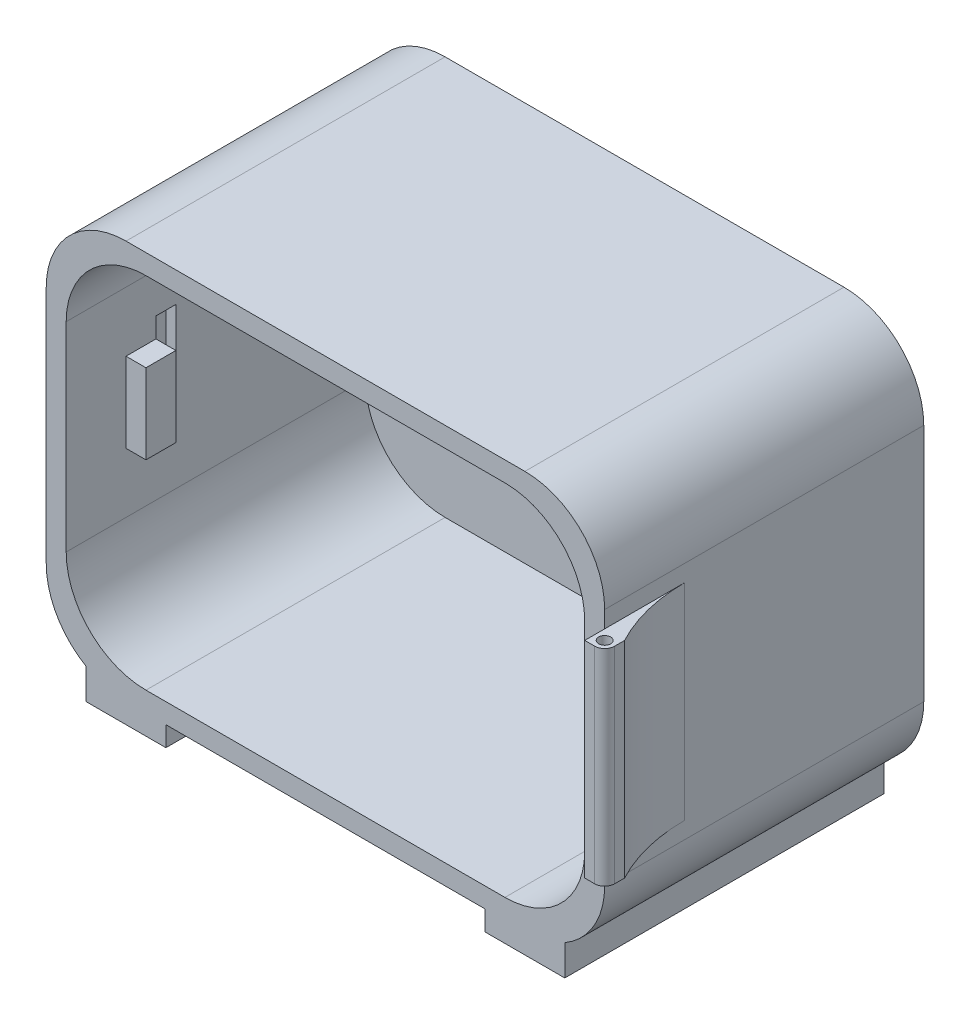
from build123d import *

# Parameters (mm, degrees)
BOSS_EXTRUDE1_DEPTH             = 95.25
BOSS_EXTRUDE2_DEPTH             = 6.35
SKETCH4_W                       = 25.4
SKETCH4_H                       = 101.6
BOSS_EXTRUDE3_DEPTH             = 6.35
BOSS_EXTRUDE3_DIRECTION_2_REACH = 187.35
BOSS_EXTRUDE5_DEPTH             = 32.766
BOSS_EXTRUDE5_DEPTH_BACK        = 32.766
SKETCH5_R                       = 1.905
FILLET1_R                       = 3.175
SKETCH8_W                       = 6.35
SKETCH8_H                       = 38.1
CUT_EXTRUDE1_DEPTH              = 3.175
SKETCH10_W                      = 9.525
SKETCH10_H                      = 25.4
BOSS_EXTRUDE6_DEPTH             = 6.35


with BuildPart() as part:
    # Sketch1 → Boss-Extrude1 (new body)
    with BuildSketch(Plane.XY):
        with BuildLine():
            Line((-63.5, 63.5), (63.5, 63.5))
            ThreePointArc((63.5, 63.5), (81.460512242, 56.060512242), (88.9, 38.1))
            Line((88.9, 38.1), (88.9, -38.1))
            ThreePointArc((88.9, -38.1), (81.460512242, -56.060512242), (63.5, -63.5))
            Line((63.5, -63.5), (-63.5, -63.5))
            ThreePointArc((-63.5, -63.5), (-81.460512242, -56.060512242), (-88.9, -38.1))
            Line((-88.9, -38.1), (-88.9, 38.1))
            ThreePointArc((-88.9, 38.1), (-81.460512242, 56.060512242), (-63.5, 63.5))
        make_face()
        with BuildLine():
            Line((-82.55, 31.75), (-82.55, -31.75))
            ThreePointArc((-82.55, -31.75), (-75.110512242, -49.710512242), (-57.15, -57.15))
            Line((-57.15, -57.15), (57.15, -57.15))
            ThreePointArc((57.15, -57.15), (75.110512242, -49.710512242), (82.55, -31.75))
            Line((82.55, -31.75), (82.55, 31.75))
            ThreePointArc((82.55, 31.75), (75.110512242, 49.710512242), (57.15, 57.15))
            Line((57.15, 57.15), (-57.15, 57.15))
            ThreePointArc((-57.15, 57.15), (-75.110512242, 49.710512242), (-82.55, 31.75))
        make_face(mode=Mode.SUBTRACT)
    extrude(amount=-BOSS_EXTRUDE1_DEPTH)

    # Sketch2 → Boss-Extrude2 (add)
    with BuildSketch(Plane(origin=(0, 0, -95.25), x_dir=(-1, 0, 0), z_dir=(0, 0, -1))):
        with BuildLine():
            Line((-63.5, 63.5), (63.5, 63.5))
            ThreePointArc((63.5, 63.5), (81.460512242, 56.060512242), (88.9, 38.1))
            Line((88.9, 38.1), (88.9, -38.1))
            ThreePointArc((88.9, -38.1), (81.460512242, -56.060512242), (63.5, -63.5))
            Line((63.5, -63.5), (-63.5, -63.5))
            ThreePointArc((-63.5, -63.5), (-81.460512242, -56.060512242), (-88.9, -38.1))
            Line((-88.9, -38.1), (-88.9, 38.1))
            ThreePointArc((-88.9, 38.1), (-81.460512242, 56.060512242), (-63.5, 63.5))
        make_face()
    extrude(amount=BOSS_EXTRUDE2_DEPTH)

    # Sketch4 → Boss-Extrude3 (add)
    with BuildSketch(Plane.XZ.offset(63.5)):
        with Locations((-63.5, -50.8)):
            Rectangle(SKETCH4_W, SKETCH4_H)
        with Locations((63.5, -50.8)):
            Rectangle(SKETCH4_W, SKETCH4_H)
    extrude(amount=BOSS_EXTRUDE3_DEPTH)

    # Sketch4 → Boss-Extrude3 direction 2 (add, up to next)
    with BuildSketch(Plane.XZ.offset(63.5), mode=Mode.PRIVATE) as boss_extrude3_direction_2_sk1:
        with Locations((-63.5, -50.8)):
            Rectangle(SKETCH4_W, SKETCH4_H)
    boss_extrude3_direction_2_tool1 = extrude(boss_extrude3_direction_2_sk1.sketch, amount=-BOSS_EXTRUDE3_DIRECTION_2_REACH, mode=Mode.PRIVATE) - part.part
    # Sketch4 → Boss-Extrude3 direction 2 (add, up to next)
    with BuildSketch(Plane.XZ.offset(63.5), mode=Mode.PRIVATE) as boss_extrude3_direction_2_sk2:
        with Locations((63.5, -50.8)):
            Rectangle(SKETCH4_W, SKETCH4_H)
    boss_extrude3_direction_2_tool2 = extrude(boss_extrude3_direction_2_sk2.sketch, amount=-BOSS_EXTRUDE3_DIRECTION_2_REACH, mode=Mode.PRIVATE) - part.part
    add(boss_extrude3_direction_2_tool1.solids().sort_by_distance((-63.5, -63.5, -50.8))[0])
    add(boss_extrude3_direction_2_tool2.solids().sort_by_distance((63.5, -63.5, -50.8))[0])

    # Sketch5 → Boss-Extrude5 (add, two sides: drawn at the far end of the back side and taken through both)
    with BuildSketch(Plane(origin=(0, 0, 0), x_dir=(1, 0, 0), z_dir=(0, 1, 0)).offset(-BOSS_EXTRUDE5_DEPTH_BACK)):
        with BuildLine():
            ThreePointArc((95.25, 0), (90.511558555, 12.309139639), (88.9, 25.4))
            Line((88.9, 25.4), (88.9, 0))
            Line((88.9, 0), (88.9, -6.35))
            Line((88.9, -6.35), (95.25, -6.35))
            Line((95.25, -6.35), (95.25, 0))
        make_face()
        with Locations((92.075, -3.175)):
            Circle(SKETCH5_R, mode=Mode.SUBTRACT)
    extrude(amount=BOSS_EXTRUDE5_DEPTH + BOSS_EXTRUDE5_DEPTH_BACK)

    # Fillet1
    fillet1_edges = [part.edges().sort_by_distance(p)[0] for p in [
        (95.25, 0, 6.35),
    ]]
    fillet(fillet1_edges, radius=FILLET1_R)

    # Sketch8 → Cut-Extrude1 (cut)
    with BuildSketch(Plane(origin=(-82.55, 0, 0), x_dir=(0, 0, -1), z_dir=(1, 0, 0))):
        with Locations((31.75, 0)):
            Rectangle(SKETCH8_W, SKETCH8_H)
    extrude(amount=-CUT_EXTRUDE1_DEPTH, mode=Mode.SUBTRACT)

    # Sketch10 → Boss-Extrude6 (add)
    with BuildSketch(Plane(origin=(-82.55, 0, 0), x_dir=(0, 0, -1), z_dir=(1, 0, 0))):
        with Locations((23.8125, 0)):
            Rectangle(SKETCH10_W, SKETCH10_H)
    extrude(amount=BOSS_EXTRUDE6_DEPTH)


solid = part.part
